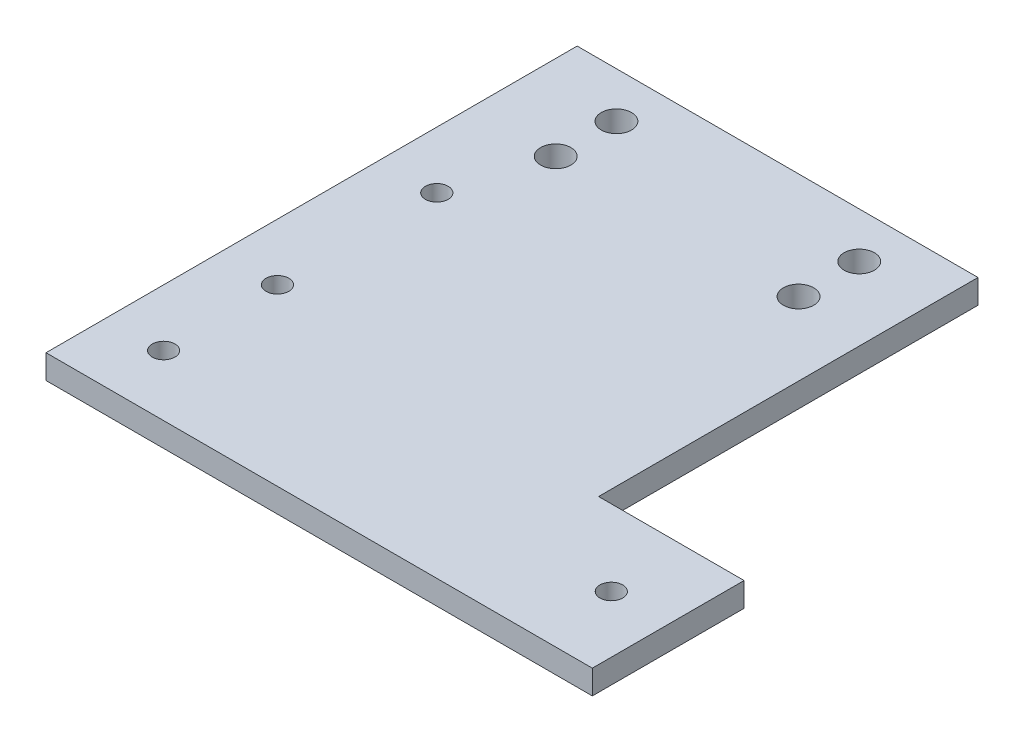
from build123d import *

# Parameters (mm, degrees)
SKETCH1_W           = 72
SKETCH1_H           = 40
SKETCH1_R           = 2
SKETCH1_R_2         = 1.5
BOSS_EXTRUDE1_DEPTH = 3.175
SKETCH2_R           = 1.5
BOSS_EXTRUDE2_DEPTH = 3.175
SKETCH3_W           = 19.175
SKETCH3_H           = 40
CUT_EXTRUDE1_DEPTH  = 3.175


with BuildPart() as part:
    # Sketch1 → Boss-Extrude1 (new body)
    with BuildSketch(Plane(origin=(0, 0, 0), x_dir=(1, 0, 0), z_dir=(0, 1, 0))):
        with Locations((36, 20)):
            Rectangle(SKETCH1_W, SKETCH1_H)
        with Locations((43.175, 26)):
            Circle(SKETCH1_R, mode=Mode.SUBTRACT)
        with Locations((64.5, 26)):
            Circle(SKETCH1_R_2, mode=Mode.SUBTRACT)
        with Locations((64.5, 14)):
            Circle(SKETCH1_R_2, mode=Mode.SUBTRACT)
        with Locations((7.5, 14)):
            Circle(SKETCH1_R_2, mode=Mode.SUBTRACT)
        with Locations((11.175, 26)):
            Circle(SKETCH1_R, mode=Mode.SUBTRACT)
        with Locations((11.175, 34)):
            Circle(SKETCH1_R, mode=Mode.SUBTRACT)
        with Locations((43.175, 34)):
            Circle(SKETCH1_R, mode=Mode.SUBTRACT)
    extrude(amount=BOSS_EXTRUDE1_DEPTH)

    # Sketch2 → Boss-Extrude2 (add)
    with BuildSketch(Plane(origin=(0, 3.175, 0), x_dir=(1, 0, 0), z_dir=(0, 1, 0))):
        Polygon((52.825, -10), (52.825, 0), (7.5, 0), (0, 0), (0, -30), (72, -30), (72, -20), (72, -10), align=None)
        with BuildLine():
            ThreePointArc((9, -22), (6.439339828, -23.060660172), (7.5, -20.5))
            ThreePointArc((7.5, -20.5), (8.560660172, -20.939339828), (9, -22))
        make_face(mode=Mode.SUBTRACT)
        with Locations((64.5, -20)):
            Circle(SKETCH2_R, mode=Mode.SUBTRACT)
        with BuildLine():
            ThreePointArc((7.5, -8.5), (6, -7), (7.5, -5.5))
            ThreePointArc((7.5, -5.5), (8.560660172, -5.939339828), (9, -7))
            ThreePointArc((9, -7), (8.560660172, -8.060660172), (7.5, -8.5))
        make_face(mode=Mode.SUBTRACT)
    extrude(amount=-BOSS_EXTRUDE2_DEPTH)

    # Sketch3 → Cut-Extrude1 (cut)
    with BuildSketch(Plane(origin=(0, 3.175, 0), x_dir=(1, 0, 0), z_dir=(0, 1, 0))):
        with Locations((62.4125, 20)):
            Rectangle(SKETCH3_W, SKETCH3_H)
    extrude(amount=-CUT_EXTRUDE1_DEPTH, mode=Mode.SUBTRACT)


solid = part.part
